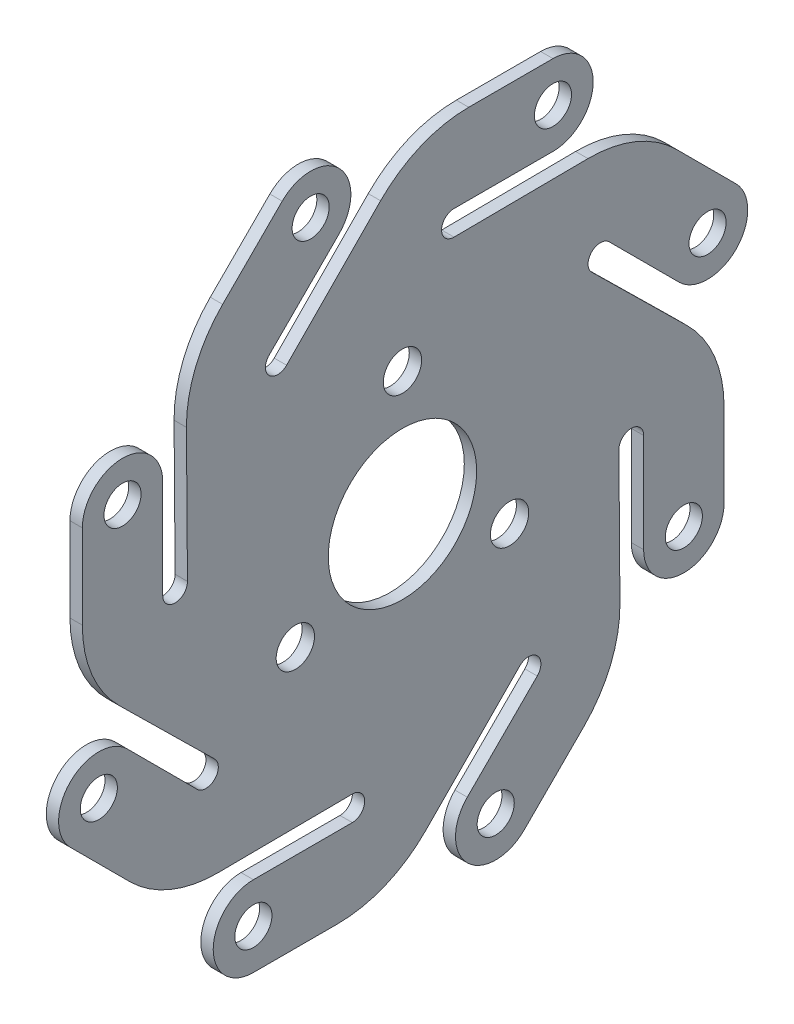
from build123d import *

# Parameters (mm, degrees)
SKETCH1_R          = 1.5
SKETCH1_R_2        = 6
SKETCH1_R_3        = 1.55
BASE_FLANGE1_DEPTH = 1


# Sheet-metal steps are written as plain solids
with BuildPart() as part:
    # Sketch1 → Base-Flange1 (new body)
    with BuildSketch(Plane(origin=(0, 0, 0), x_dir=(0, 0, -1), z_dir=(1, 0, 0))):
        with BuildLine():
            Line((15.298384889, 9.287443872), (23.016301233, 1.688033071))
            ThreePointArc((23.016301233, 1.688033071), (25.224073123, -1.574984432), (26.00015012, -5.437528209))
            Line((26.00015012, -5.437528209), (26.00015012, -12.25))
            ThreePointArc((26.00015012, -12.25), (22.75007506, -15.50007506), (19.5, -12.25))
            Line((19.5, -12.25), (19.5, -4.25))
            ThreePointArc((19.5, -4.25), (18.5, -3.25), (17.5, -4.25))
            Line((17.5, -4.25), (17.583796073, -15.080985895))
            ThreePointArc((17.583796073, -15.080985895), (16.837624745, -18.949418172), (14.655163154, -22.229418377))
            Line((14.655163154, -22.229418377), (9.838018154, -27.046563377))
            ThreePointArc((9.838018154, -27.046563377), (5.241717926, -27.046563377), (5.241717926, -22.450263149))
            Line((5.241717926, -22.450263149), (10.898572175, -16.793408899))
            ThreePointArc((10.898572175, -16.793408899), (10.898572175, -15.379195337), (9.484358613, -15.379195337))
            Line((9.484358613, -15.379195337), (1.884947812, -23.097111681))
            ThreePointArc((1.884947812, -23.097111681), (-1.378069691, -25.304883571), (-5.240613468, -26.080960568))
            Line((-5.240613468, -26.080960568), (-12.053085259, -26.080960568))
            ThreePointArc((-12.053085259, -26.080960568), (-15.303160319, -22.830885508), (-12.053085259, -19.580810448))
            Line((-12.053085259, -19.580810448), (-4.053085259, -19.580810448))
            ThreePointArc((-4.053085259, -19.580810448), (-3.053085259, -18.580810448), (-4.053085259, -17.580810448))
            Line((-4.053085259, -17.580810448), (-14.884071154, -17.664606521))
            ThreePointArc((-14.884071154, -17.664606521), (-18.752503431, -16.918435193), (-22.032503636, -14.735973602))
            Line((-22.032503636, -14.735973602), (-26.849648636, -9.918828602))
            ThreePointArc((-26.849648636, -9.918828602), (-26.849648636, -5.322528374), (-22.253348408, -5.322528374))
            Line((-22.253348408, -5.322528374), (-16.596494158, -10.979382623))
            ThreePointArc((-16.596494158, -10.979382623), (-15.182280596, -10.979382623), (-15.182280596, -9.565169061))
            Line((-15.182280596, -9.565169061), (-22.90019694, -1.96575826))
            ThreePointArc((-22.90019694, -1.96575826), (-25.10796883, 1.297259243), (-25.884045827, 5.15980302))
            Line((-25.884045827, 5.15980302), (-25.884045827, 11.972274811))
            ThreePointArc((-25.884045827, 11.972274811), (-22.633970767, 15.222349871), (-19.383895707, 11.972274811))
            Line((-19.383895707, 11.972274811), (-19.383895707, 3.972274811))
            ThreePointArc((-19.383895707, 3.972274811), (-18.383895707, 2.964508185), (-17.383895707, 3.972274811))
            Line((-17.383895707, 3.972274811), (-17.46769178, 14.803260706))
            ThreePointArc((-17.46769178, 14.803260706), (-16.721520452, 18.671692983), (-14.539058861, 21.951693188))
            Line((-14.539058861, 21.951693188), (-9.721913861, 26.768838188))
            ThreePointArc((-9.721913861, 26.768838188), (-5.125613633, 26.768838188), (-5.125613633, 22.17253796))
            Line((-5.125613633, 22.17253796), (-10.782467882, 16.51568371))
            ThreePointArc((-10.782467882, 16.51568371), (-10.787959717, 15.095978314), (-9.36825432, 15.101470148))
            Line((-9.36825432, 15.101470148), (-1.768843519, 22.819386492))
            ThreePointArc((-1.768843519, 22.819386492), (1.494173984, 25.027158382), (5.356717761, 25.803235379))
            Line((5.356717761, 25.803235379), (12.169189552, 25.803235379))
            ThreePointArc((12.169189552, 25.803235379), (15.419264612, 22.553160319), (12.169189552, 19.303085259))
            Line((12.169189552, 19.303085259), (4.169189552, 19.303085259))
            ThreePointArc((4.169189552, 19.303085259), (3.161422926, 18.303085259), (4.169189552, 17.303085259))
            Line((4.169189552, 17.303085259), (15.000175447, 17.386881332))
            ThreePointArc((15.000175447, 17.386881332), (18.868607724, 16.640710004), (22.148607929, 14.458248413))
            Line((22.148607929, 14.458248413), (26.965752929, 9.641103413))
            ThreePointArc((26.965752929, 9.641103413), (26.965752929, 5.044803185), (22.369452701, 5.044803185))
            Line((22.369452701, 5.044803185), (16.712598451, 10.701657434))
            ThreePointArc((16.712598451, 10.701657434), (15.298384889, 10.701657434), (15.298384889, 9.287443872))
        make_face()
        with Locations((22.75007506, -12.25)):
            Circle(SKETCH1_R, mode=Mode.SUBTRACT)
        with Locations((7.53986804, -24.748413263)):
            Circle(SKETCH1_R, mode=Mode.SUBTRACT)
        with Locations((-12.053085259, -22.830885508)):
            Circle(SKETCH1_R, mode=Mode.SUBTRACT)
        with Locations((-24.551498522, -7.620678488)):
            Circle(SKETCH1_R, mode=Mode.SUBTRACT)
        with Locations((-22.633970767, 11.972274811)):
            Circle(SKETCH1_R, mode=Mode.SUBTRACT)
        with Locations((-7.423763747, 24.470688074)):
            Circle(SKETCH1_R, mode=Mode.SUBTRACT)
        with Locations((12.169189552, 22.553160319)):
            Circle(SKETCH1_R, mode=Mode.SUBTRACT)
        with Locations((24.667602815, 7.342953299)):
            Circle(SKETCH1_R, mode=Mode.SUBTRACT)
        Circle(SKETCH1_R_2, mode=Mode.SUBTRACT)
        with Locations((0, 10)):
            Circle(SKETCH1_R_3, mode=Mode.SUBTRACT)
        with Locations((8.660254038, -5)):
            Circle(SKETCH1_R_3, mode=Mode.SUBTRACT)
        with Locations((-8.660254038, -5)):
            Circle(SKETCH1_R_3, mode=Mode.SUBTRACT)
    extrude(amount=-BASE_FLANGE1_DEPTH)


solid = part.part
